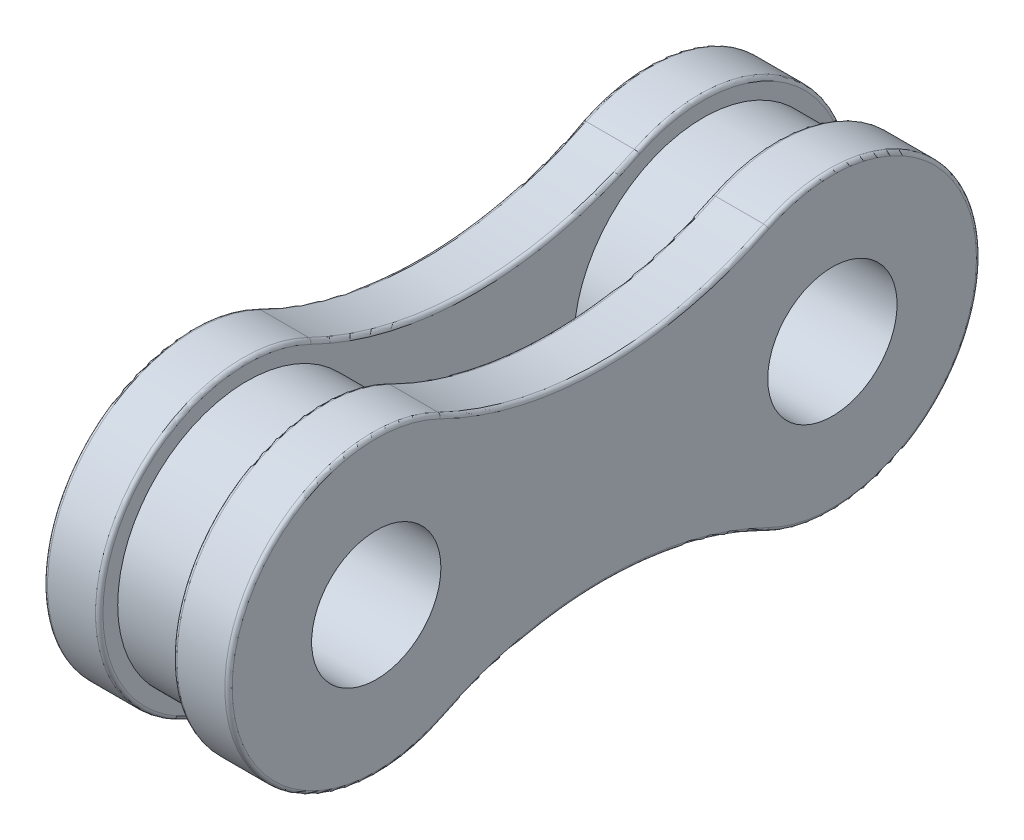
from build123d import *

# Parameters (mm, degrees)
BOSS_EXTRUDE1_START = 1000
SKETCH1_R           = 1750
BOSS_EXTRUDE1_DEPTH = 1500
BOSS_EXTRUDE2_START = -1000
SKETCH2_R           = 1750
BOSS_EXTRUDE2_DEPTH = 1500
SKETCH3_R           = 3500
SKETCH3_R_2         = 1750
BOSS_EXTRUDE3_DEPTH = 1000
FILLET1_R           = 100


with BuildPart() as part:
    # Sketch1 → Boss-Extrude1 (new body)
    with BuildSketch(Plane(origin=(0, 0, 0), x_dir=(0, 0, -1), z_dir=(1, 0, 0)).offset(BOSS_EXTRUDE1_START)):
        with BuildLine():
            ThreePointArc((-4410.714285714, 3589.888009168), (-10175, 0), (-4410.714285714, -3589.888009168))
            ThreePointArc((-4410.714285714, -3589.888009168), (0, -2564.608032088), (4410.714285714, -3589.888009168))
            ThreePointArc((4410.714285714, -3589.888009168), (10175, 0), (4410.714285714, 3589.888009168))
            ThreePointArc((4410.714285714, 3589.888009168), (0, 2564.608032088), (-4410.714285714, 3589.888009168))
        make_face()
        with Locations((-6175, 0)):
            Circle(SKETCH1_R, mode=Mode.SUBTRACT)
        with Locations((6175, 0)):
            Circle(SKETCH1_R, mode=Mode.SUBTRACT)
    extrude(amount=BOSS_EXTRUDE1_DEPTH)



with BuildPart() as body_2:
    # Sketch2 → Boss-Extrude2 (new body)
    with BuildSketch(Plane(origin=(0, 0, 0), x_dir=(0, 0, -1), z_dir=(1, 0, 0)).offset(BOSS_EXTRUDE2_START)):
        with BuildLine():
            ThreePointArc((4410.714285714, -3589.888009168), (0, -2564.608032088), (-4410.714285714, -3589.888009168))
            ThreePointArc((-4410.714285714, -3589.888009168), (-10175, 0), (-4410.714285714, 3589.888009168))
            ThreePointArc((-4410.714285714, 3589.888009168), (0, 2564.608032088), (4410.714285714, 3589.888009168))
            ThreePointArc((4410.714285714, 3589.888009168), (10175, 0), (4410.714285714, -3589.888009168))
        make_face()
        with Locations((-6175, 0)):
            Circle(SKETCH2_R, mode=Mode.SUBTRACT)
        with Locations((6175, 0)):
            Circle(SKETCH2_R, mode=Mode.SUBTRACT)
    extrude(amount=-BOSS_EXTRUDE2_DEPTH)


with BuildPart() as part_1:
    add(part.part)

    add(body_2.part)  # Boss-Extrude3 merges body 2
    # Sketch3 → Boss-Extrude3 (add, symmetric)
    # profile 1 of 2: a face of its own
    with BuildSketch(Plane(origin=(0, 0, 0), x_dir=(0, 0, -1), z_dir=(1, 0, 0))):
        with Locations((6175, 0)):
            Circle(SKETCH3_R)
        with Locations((6175, 0)):
            Circle(SKETCH3_R_2, mode=Mode.SUBTRACT)
    # profile 2 of 2: a face of its own
    with BuildSketch(Plane(origin=(0, 0, 0), x_dir=(0, 0, -1), z_dir=(1, 0, 0))):
        with Locations((-6175, 0)):
            Circle(SKETCH3_R)
        with Locations((-6175, 0)):
            Circle(SKETCH3_R_2, mode=Mode.SUBTRACT)
    extrude(amount=BOSS_EXTRUDE3_DEPTH, both=True)

    # Fillet1
    fillet1_edges = [part_1.edges().sort_by_distance(p)[0] for p in [
        (2500, 0, 10175),
        (2500, 2564.608032088, 0),
        (2500, 0, -10175),
        (1000, 0, 10175),
        (1000, 2564.608032088, 0),
        (1000, 0, -10175),
        (-1000, 0, 10175),
        (-1000, 2564.608032088, 0),
        (-1000, 0, -10175),
        (-2500, 0, 10175),
        (-2500, 2564.608032088, 0),
        (-2500, 0, -10175),
        (2500, -2564.608032088, 0),
        (1000, -2564.608032088, 0),
        (-1000, -2564.608032088, 0),
        (-2500, -2564.608032088, 0),
    ]]
    fillet(fillet1_edges, radius=FILLET1_R)


solid = part_1.part
